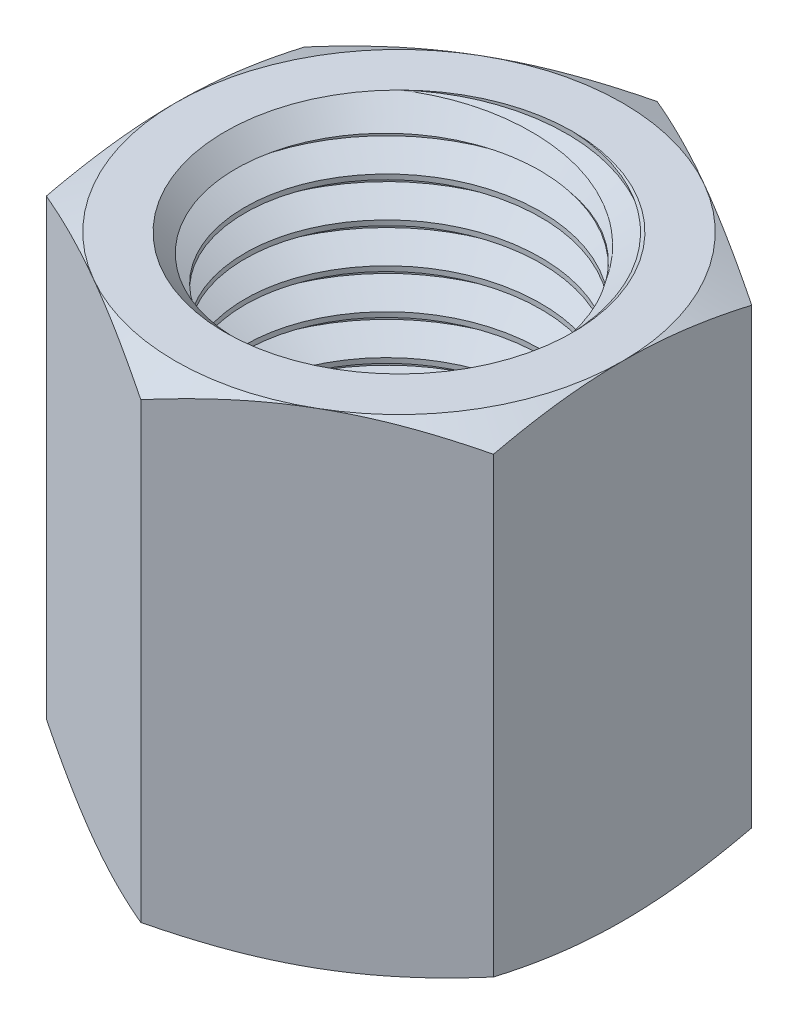
from build123d import *

# Parameters (mm, degrees)
EXTRUDE1_DEPTH   = 15.494
SKETCH2_W        = 5.55625
SKETCH2_H        = 15.494
CUT_SWEEP1_PITCH = 1.27
FILLET1_R        = 0.127


with BuildPart() as part:
    # Sketch1 → Extrude1 (new body)
    with BuildSketch(Plane(origin=(0, 0, 0), x_dir=(1, 0, 0), z_dir=(0, 1, 0))):
        Polygon((0, 8.248891971), (-7.14375, 4.124445986), (-7.14375, -4.124445986), (0, -8.248891971), (7.14375, -4.124445986), (7.14375, 4.124445986), align=None)
    extrude(amount=EXTRUDE1_DEPTH)


with BuildPart() as body_2:
    # Sketch2 → Revolve1 (revolve)
    with BuildSketch(Plane(origin=(0, 0, 0), x_dir=(0, 0, -1), z_dir=(1, 0, 0))):
        with Locations((2.778125, 7.747)):
            Rectangle(SKETCH2_W, SKETCH2_H)
    revolve(axis=Axis((0, -5.55625, 0), (0, 1, 0)))

    # Cut-Sweep1: the profile of Sketch10 profile screwed along a right-hand helix of 25.984252 turns, 8 arcs to a turn; built about Z, then put on its axis
    cut_sweep1_z = Axis((0, 0, 0), (0, 0, 1))
    cut_sweep1_corners = [(5.55655, 0, -1.111423205), (5.55655, 0, 0.000173205), (4.731360803, 0, -0.47625), (4.731360803, 0, -0.635)]
    with BuildLine(mode=Mode.PRIVATE) as cut_sweep1_profile:
        Line(cut_sweep1_corners[0], cut_sweep1_corners[1])
        Line(cut_sweep1_corners[1], cut_sweep1_corners[2])
        Line(cut_sweep1_corners[2], cut_sweep1_corners[3])
        Line(cut_sweep1_corners[3], cut_sweep1_corners[0])
    cut_sweep1_cap = Face(cut_sweep1_profile.wire())
    cut_sweep1_turn_angles = [0, 22.5, 45, 67.5, 90, 112.5, 135, 157.5, 180, 202.5, 225, 247.5, 270, 292.5, 315, 337.5, 360]
    cut_sweep1_turn_weights = [1, 0.9238795325112867, 1, 0.9238795325112867, 1, 0.9238795325112867, 1, 0.9238795325112867, 1, 0.9238795325112867, 1, 0.9238795325112867, 1, 0.9238795325112867, 1, 0.9238795325112867, 1]
    cut_sweep1_turn_rails = [Edge.make_bspline([Vector(p[0], p[1], 0).rotate(cut_sweep1_z, cut_sweep1_turn_angles[k]) / cut_sweep1_turn_weights[k] + Vector(0, 0, p[2] + CUT_SWEEP1_PITCH * cut_sweep1_turn_angles[k] / 360) for k in range(17)], [0, 0, 0, 1, 1, 2, 2, 3, 3, 4, 4, 5, 5, 6, 6, 7, 7, 8, 8, 8], 2, cut_sweep1_turn_weights) for p in cut_sweep1_corners]
    cut_sweep1_turn_sides = [Face.make_surface_from_curves(cut_sweep1_turn_rails[p[0]], cut_sweep1_turn_rails[p[1]]) for p in [(0, 1), (1, 2), (2, 3), (3, 0)]]
    cut_sweep1_last_angles = [9000, 9022.5, 9045, 9067.5, 9090, 9112.5, 9135, 9157.5, 9180, 9202.5, 9225, 9247.5, 9270, 9292.5, 9315, 9334.665354331, 9354.330708662]
    cut_sweep1_last_weights = [1, 0.9238795325112867, 1, 0.9238795325112867, 1, 0.9238795325112867, 1, 0.9238795325112867, 1, 0.9238795325112867, 1, 0.9238795325112867, 1, 0.9238795325112867, 1, 0.9416742077783308, 1]
    cut_sweep1_last_rails = [Edge.make_bspline([Vector(p[0], p[1], 0).rotate(cut_sweep1_z, cut_sweep1_last_angles[k]) / cut_sweep1_last_weights[k] + Vector(0, 0, p[2] + CUT_SWEEP1_PITCH * cut_sweep1_last_angles[k] / 360) for k in range(17)], [0, 0, 0, 1, 1, 2, 2, 3, 3, 4, 4, 5, 5, 6, 6, 7, 7, 8, 8, 8], 2, cut_sweep1_last_weights) for p in cut_sweep1_corners]
    cut_sweep1_last_sides = [Face.make_surface_from_curves(cut_sweep1_last_rails[p[0]], cut_sweep1_last_rails[p[1]]) for p in [(0, 1), (1, 2), (2, 3), (3, 0)]]
    cut_sweep1 = Plane(origin=(0, 15.494, 0), x_dir=(0, 0, -1), z_dir=(0, -1, 0)) * Solid(Shell([*[p.moved(Location((0, 0, CUT_SWEEP1_PITCH * i))) for i in range(25) for p in cut_sweep1_turn_sides], *cut_sweep1_last_sides, cut_sweep1_cap, cut_sweep1_cap.rotate(cut_sweep1_z, 9354.330708662).moved(Location((0, 0, CUT_SWEEP1_PITCH * 9354.330708662 / 360)))]))
    add(cut_sweep1, mode=Mode.SUBTRACT)


with BuildPart() as part_1:
    add(part.part)

    # Combine1: cut body 2
    add(body_2.part, mode=Mode.SUBTRACT)

    # Cut-Extrude1 cone 1 section (through the dimple's axis) → Cut-Extrude1 (revolve, cut)
    with BuildSketch(Plane(origin=(0, 15.494, 0), x_dir=(0, 0, 1), z_dir=(1, 0, 0))):
        Polygon((0, 0), (5.55625, 0), (0, 5.55625), align=None)
    revolve(axis=Axis((0, 15.494, 0), (0, -1, 0)), mode=Mode.SUBTRACT)

    # Sketch5 → Cut-Revolve3 (revolve, cut)
    with BuildSketch(Plane(origin=(0, 0, 0), x_dir=(0, 0, -1), z_dir=(1, 0, 0))):
        Polygon((0, 0), (7.14375, 0), (8.248891971, 0.515336164), (8.248891971, 14.978663836), (7.14375, 15.494), (0, 15.494), (0, 16.764), (9.518891971, 16.764), (9.518891971, -1.27), (0, -1.27), align=None)
    revolve(axis=Axis((0, 0, 0), (0, 1, 0)), mode=Mode.SUBTRACT)

    # Sketch7 → Revolve2 (revolve)
    with BuildSketch(Plane(origin=(0, 0, 0), x_dir=(0, 0, -1), z_dir=(1, 0, 0))):
        Polygon((0, 0), (5.55625, 0), (5.55625, 1.93675), (5.55625, 5.49275), (0, 5.49275), (0, 1.93675), align=None)
    revolve(axis=Axis((0, 0, 0), (0, 1, 0)))

    # Sketch8 → Cut-Revolve4 (revolve, cut)
    with BuildSketch(Plane(origin=(0, 0, 0), x_dir=(0, 0, -1), z_dir=(1, 0, 0))):
        Polygon((0, 0), (3.937, 0), (3.937, 1.93675), (4.826, 1.93675), (4.826, 5.49275), (0, 5.49275), (0, 1.93675), align=None)
    revolve(axis=Axis((0, 0, 0), (0, 1, 0)), mode=Mode.SUBTRACT)

    # Fillet1
    fillet1_edges = [part_1.edges().sort_by_distance(p)[0] for p in [
        (0, 1.93675, 4.826),
    ]]
    fillet(fillet1_edges, radius=FILLET1_R)


solid = part_1.part
